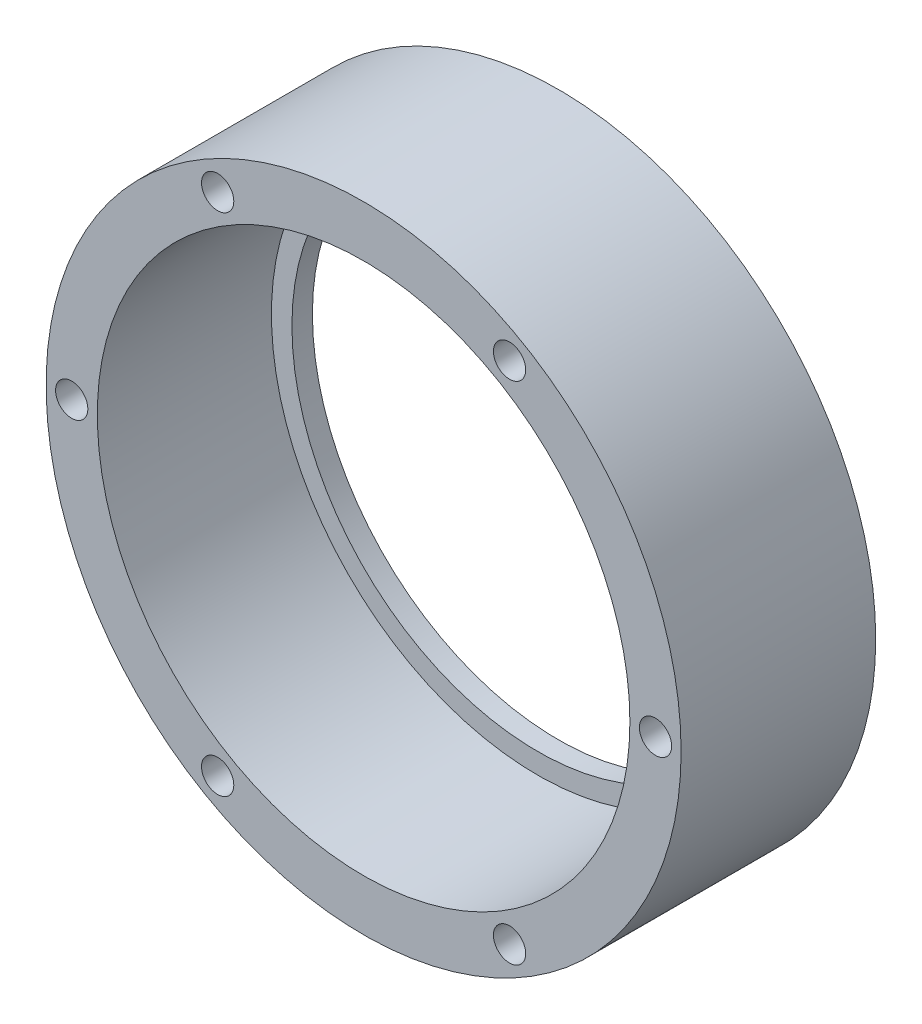
from build123d import *

# Parameters (mm, degrees)
PATTERN_CIRCULAR_1_COUNT = 6


with BuildPart() as part:
    # Эскиз1 → Повернуть1 (revolve)
    with BuildSketch(Plane(origin=(0, 0, 0), x_dir=(0, 0, -1), z_dir=(1, 0, 0))):
        Polygon((0, 31), (19, 31), (19, 24), (17, 24), (17, 26), (0, 26), align=None)
    revolve(axis=Axis((0, 0, 0), (0, 0, -1)))

    # Эскиз3 → Сверло под метчик  спиральное M31 (revolve, cut)
    with BuildSketch(Plane(origin=(28.5, 0, 0), x_dir=(0, -1, 0), z_dir=(1, 0, 0))):
        Polygon((0, 0), (0, 8.946355475), (1.575, 8), (1.575, 0), align=None)
    hole_wizard_m31 = revolve(axis=Axis((28.5, 0, 6.35), (0, 0, -1)), mode=Mode.SUBTRACT)

    # Круговой массив1: Сверло под метчик  спиральное M31 ×6 about axis
    pattern_circular_1_axis = Axis((0, 0, 0), (0, 0, 1))
    for i in range(1, PATTERN_CIRCULAR_1_COUNT):
        add(hole_wizard_m31.rotate(pattern_circular_1_axis, i * 360 / PATTERN_CIRCULAR_1_COUNT), mode=Mode.SUBTRACT)


solid = part.part
